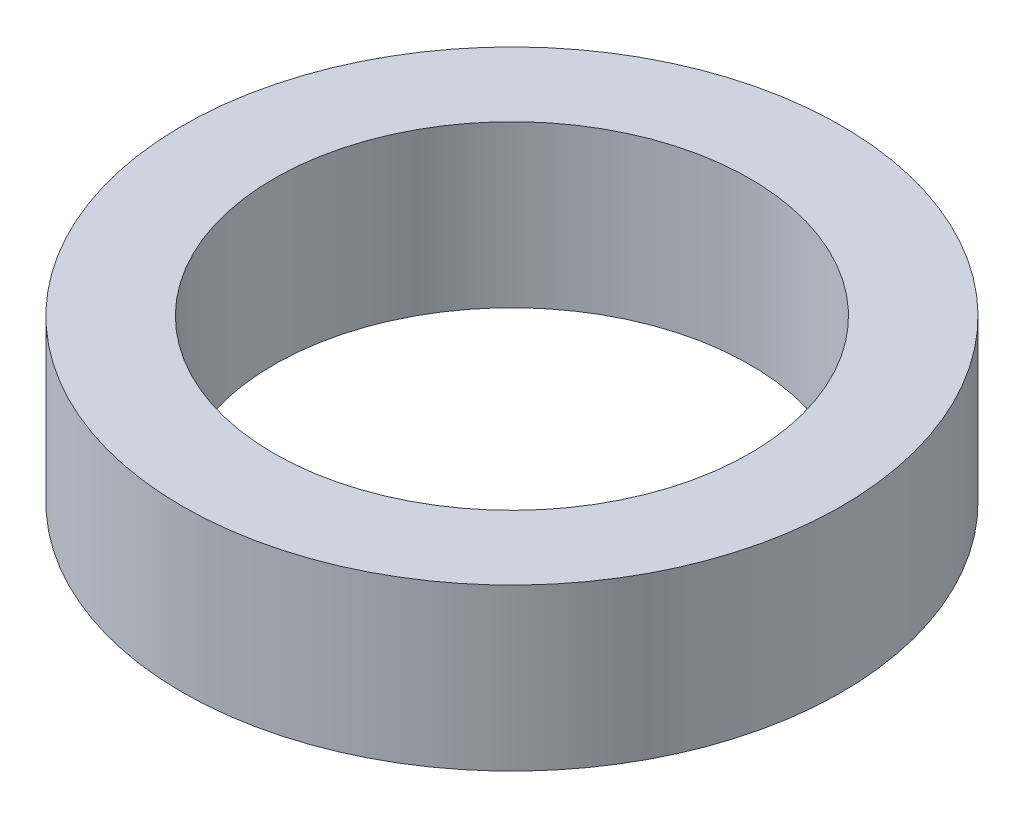
from build123d import *

# Parameters (mm, degrees)
SKETCH1_R           = 45
BOSS_EXTRUDE1_DEPTH = 22
SKETCH2_R           = 32.5
CUT_EXTRUDE1_DEPTH  = 68.334983478


with BuildPart() as part:
    # Sketch1 → Boss-Extrude1 (new body)
    with BuildSketch(Plane(origin=(0, 0, 0), x_dir=(1, 0, 0), z_dir=(0, 1, 0))):
        Circle(SKETCH1_R)
    extrude(amount=BOSS_EXTRUDE1_DEPTH)

    # Sketch2 → Cut-Extrude1 (cut, through all)
    with BuildSketch(Plane(origin=(0, 0, 0), x_dir=(1, 0, 0), z_dir=(0, 1, 0))):
        Circle(SKETCH2_R)
    extrude(amount=CUT_EXTRUDE1_DEPTH, mode=Mode.SUBTRACT)


solid = part.part
